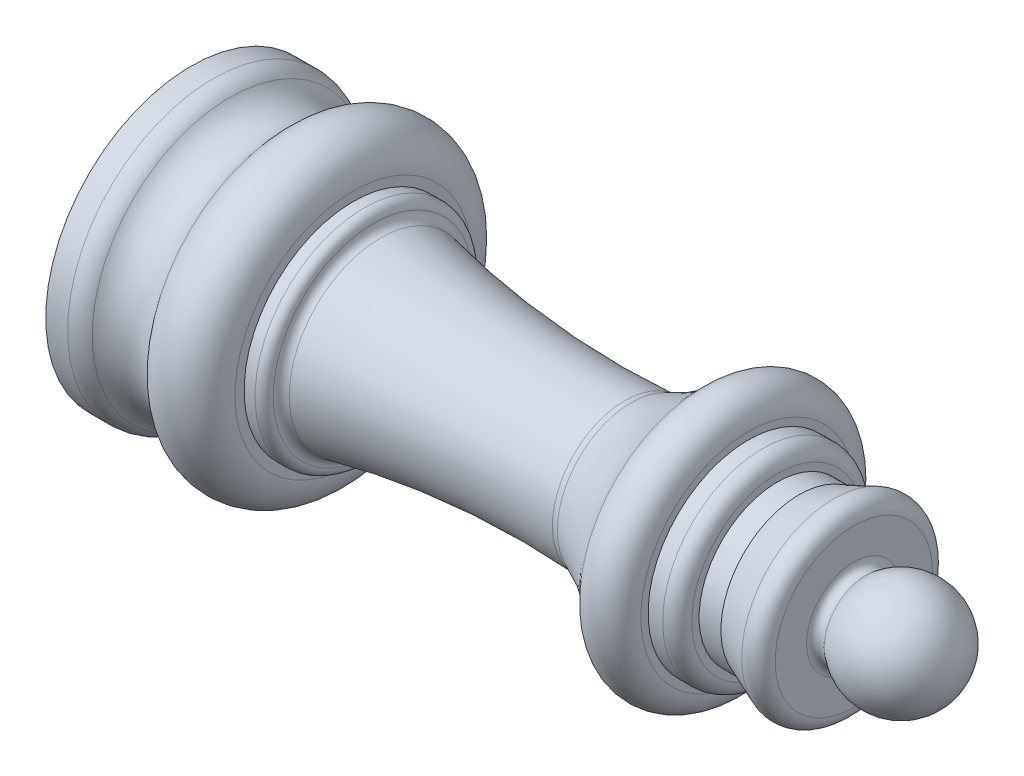
from build123d import *

# Parameters (mm, degrees)
FILLET_1_R = 2
FILLET_3_R = 3


with BuildPart() as part:
    # 草圖1 → 旋轉1 (revolve)
    with BuildSketch(Plane.XY):
        with BuildLine():
            Line((-14, 6.480740698), (-14, 13.75))
            Line((-14, 13.75), (-21.5, 10.75))
            Line((-21.5, 10.75), (-24.5, 10.75))
            Line((-24.5, 10.75), (-24.5, 13.75))
            Line((-24.5, 13.75), (-28.5, 13.75))
            Line((-28.5, 13.75), (-28.5, 14.75))
            ThreePointArc((-28.5, 14.75), (-30.786877094, 18), (-34.637471586, 17.017539364))
            ThreePointArc((-34.637471586, 17.017539364), (-39.363091591, 12.835937548), (-45, 10))
            ThreePointArc((-45, 10), (-62.092533005, 10.09842212), (-79.01183648, 12.527730939))
            ThreePointArc((-79.01183648, 12.527730939), (-79.722058537, 12.964123292), (-80, 13.75))
            ThreePointArc((-80, 13.75), (-80.366116524, 14.633883476), (-81.25, 15))
            Line((-81.25, 15), (-82.75, 15))
            Line((-82.75, 15), (-82.75, 16.25))
            ThreePointArc((-82.75, 16.25), (-86.208567412, 21.006467762), (-91.79959423, 19.182709766))
            ThreePointArc((-91.79959423, 19.182709766), (-95.681792866, 17.118222446), (-99.693445708, 18.918282341))
            ThreePointArc((-99.693445708, 18.918282341), (-100.726196071, 19.71614129), (-102, 20))
            Line((-102, 20), (-105, 20))
            Line((-105, 20), (-105, 0))
            Line((-105, 0), (0, 0))
            ThreePointArc((0, 0), (-4.349369811, 6.806139097), (-12.352941176, 5.718300616))
            ThreePointArc((-12.352941176, 5.718300616), (-13.420084025, 5.573255485), (-14, 6.480740698))
        make_face()
    revolve(axis=Axis((0, 0, 0), (-1, 0, 0)))

    # 草圖1<3> → 旋轉3 (revolve)
    with BuildSketch(Plane.XY):
        with BuildLine():
            Line((-14, 6.480740698), (-14, 13.75))
            Line((-14, 13.75), (-21.5, 10.75))
            Line((-21.5, 10.75), (-24.5, 10.75))
            Line((-24.5, 10.75), (-24.5, 13.75))
            Line((-24.5, 13.75), (-28.5, 13.75))
            Line((-28.5, 13.75), (-28.5, 14.75))
            ThreePointArc((-28.5, 14.75), (-30.786877094, 18), (-34.637471586, 17.017539364))
            ThreePointArc((-34.637471586, 17.017539364), (-39.363091591, 12.835937548), (-45, 10))
            ThreePointArc((-45, 10), (-62.092533005, 10.09842212), (-79.01183648, 12.527730939))
            ThreePointArc((-79.01183648, 12.527730939), (-79.722058537, 12.964123292), (-80, 13.75))
            ThreePointArc((-80, 13.75), (-80.366116524, 14.633883476), (-81.25, 15))
            Line((-81.25, 15), (-82.75, 15))
            Line((-82.75, 15), (-82.75, 16.25))
            ThreePointArc((-82.75, 16.25), (-86.208567412, 21.006467762), (-91.79959423, 19.182709766))
            ThreePointArc((-91.79959423, 19.182709766), (-95.681792866, 17.118222446), (-99.693445708, 18.918282341))
            ThreePointArc((-99.693445708, 18.918282341), (-100.726196071, 19.71614129), (-102, 20))
            Line((-102, 20), (-105, 20))
            Line((-105, 20), (-105, 0))
            Line((-105, 0), (0, 0))
            ThreePointArc((0, 0), (-4.349369811, 6.806139097), (-12.352941176, 5.718300616))
            ThreePointArc((-12.352941176, 5.718300616), (-13.420084025, 5.573255485), (-14, 6.480740698))
        make_face()
    revolve(axis=Axis((0, 0, 0), (-1, 0, 0)))

    # 圓角1
    fillet_1_edges = [part.edges().sort_by_distance(p)[0] for p in [
        (-24.5, -13.75, 0),
        (-14, -13.75, 0),
    ]]
    fillet(fillet_1_edges, radius=FILLET_1_R)

    # 圓角3
    fillet_3_edges = [part.edges().sort_by_distance(p)[0] for p in [
        (-45, -10, 0),
    ]]
    fillet(fillet_3_edges, radius=FILLET_3_R)


solid = part.part
